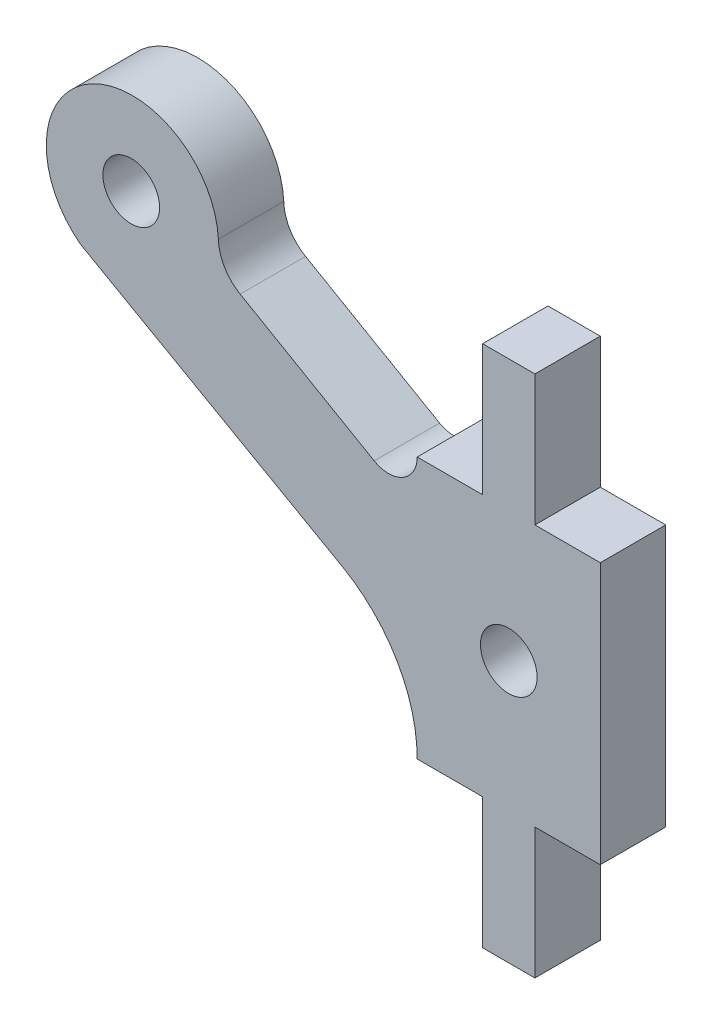
from build123d import *

# Parameters (mm, degrees)
MODEL_R             = 1.3
MODEL_R_2           = 1.300004804
BOSS_EXTRUDE1_DEPTH = 3


with BuildPart() as part:
    # Model → Boss-Extrude1 (new body)
    with BuildSketch(Plane.XY):
        with BuildLine():
            Line((74.231368849, 35.61311115), (74.231368849, 47.61311115))
            Line((74.231368849, 47.61311115), (71.231386535, 47.61311115))
            Line((71.231386535, 47.61311115), (71.231386535, 53.61311115))
            Line((71.231386535, 53.61311115), (68.83138654, 53.61311115))
            Line((68.83138654, 53.61311115), (68.83138654, 47.613005099))
            Line((68.83138654, 47.613005099), (65.83136885, 47.613005099))
            ThreePointArc((65.83136885, 47.613005099), (65.173213816, 46.473407151), (63.8572156, 46.472930832))
            Line((63.8572156, 46.472930832), (57.710211056, 50.022418261))
            ThreePointArc((57.710211056, 50.022418261), (56.990071165, 50.734303435), (56.710901802, 51.707672034))
            ThreePointArc((56.710901802, 51.707672034), (50.904413755, 54.977754044), (50.393576956, 48.333374046))
            Line((50.393576956, 48.333374046), (62.414363078, 41.532318088))
            ThreePointArc((62.414363078, 41.532318088), (64.915944961, 39.030436678), (65.831368849, 35.61293443))
            Line((65.831368849, 35.61293443), (68.831386538, 35.61293443))
            Line((68.831386538, 35.61293443), (68.831386538, 29.61311115))
            Line((68.831386538, 29.61311115), (71.231386533, 29.61311115))
            Line((71.231386533, 29.61311115), (71.231386533, 35.61311115))
            Line((71.231386533, 35.61311115), (74.231368849, 35.61311115))
        make_face()
        with Locations((70.031775439, 41.612672771)):
            Circle(MODEL_R, mode=Mode.SUBTRACT)
        with Locations((52.711979414, 51.613979963)):
            Circle(MODEL_R_2, mode=Mode.SUBTRACT)
    extrude(amount=BOSS_EXTRUDE1_DEPTH)


solid = part.part
